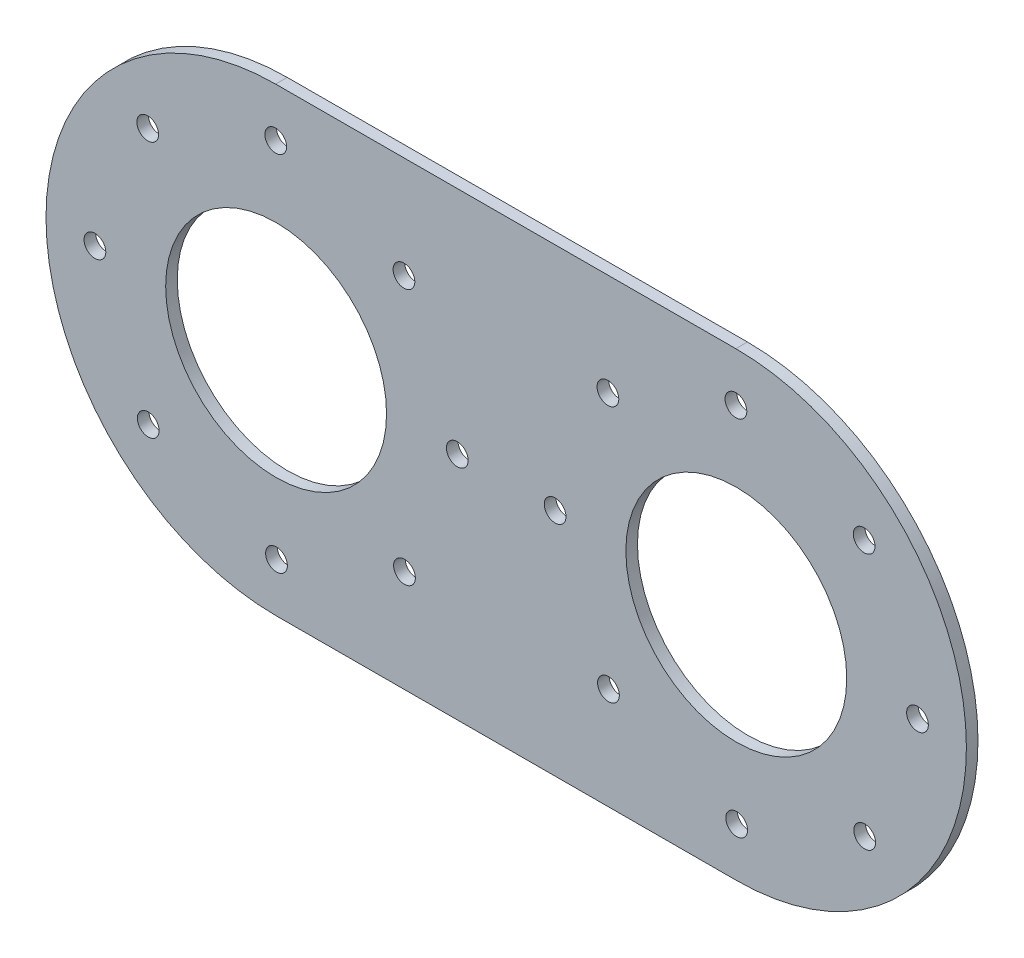
from build123d import *

# Parameters (mm, degrees)
SKETCH1_R           = 0.75
SKETCH1_R_2         = 7.62
BOSS_EXTRUDE1_DEPTH = 0.8


with BuildPart() as part:
    # Sketch1 → Boss-Extrude1 (new body)
    with BuildSketch(Plane.XY):
        with BuildLine():
            Line((31.717398128, 12.445094013), (-0.032601872, 12.379890131))
            ThreePointArc((-0.032601872, 12.379890131), (-15.874966523, -3.527678264), (0.032601872, -19.370042915))
            Line((0.032601872, -19.370042915), (31.782601872, -19.304839034))
            ThreePointArc((31.782601872, -19.304839034), (47.624966523, -3.397270638), (31.717398128, 12.445094013))
        make_face()
        with Locations((19.25, -3.45554333)):
            Circle(SKETCH1_R, mode=Mode.SUBTRACT)
        with Locations((31.75, -3.42987251)):
            Circle(SKETCH1_R_2, mode=Mode.SUBTRACT)
        with Locations((44.25, -3.404201691)):
            Circle(SKETCH1_R, mode=Mode.SUBTRACT)
        with Locations((22.929317246, -12.286859286)):
            Circle(SKETCH1_R, mode=Mode.SUBTRACT)
        with Locations((31.77567082, -15.92987251)):
            Circle(SKETCH1_R, mode=Mode.SUBTRACT)
        with Locations((40.606986775, -12.250555265)):
            Circle(SKETCH1_R, mode=Mode.SUBTRACT)
        with Locations((22.893013225, 5.390810244)):
            Circle(SKETCH1_R, mode=Mode.SUBTRACT)
        with Locations((31.72432918, 9.07012749)):
            Circle(SKETCH1_R, mode=Mode.SUBTRACT)
        with Locations((40.570682754, 5.427114265)):
            Circle(SKETCH1_R, mode=Mode.SUBTRACT)
        with Locations((0.02567082, -15.995076392)):
            Circle(SKETCH1_R, mode=Mode.SUBTRACT)
        with Locations((8.856986775, -12.315759146)):
            Circle(SKETCH1_R, mode=Mode.SUBTRACT)
        with Locations((-12.5, -3.520747212)):
            Circle(SKETCH1_R, mode=Mode.SUBTRACT)
        with Locations((0, -3.495076392)):
            Circle(SKETCH1_R_2, mode=Mode.SUBTRACT)
        with Locations((12.5, -3.469405573)):
            Circle(SKETCH1_R, mode=Mode.SUBTRACT)
        with Locations((-8.820682754, -12.352063168)):
            Circle(SKETCH1_R, mode=Mode.SUBTRACT)
        with Locations((8.820682754, 5.361910383)):
            Circle(SKETCH1_R, mode=Mode.SUBTRACT)
        with Locations((-8.856986775, 5.325606362)):
            Circle(SKETCH1_R, mode=Mode.SUBTRACT)
        with Locations((-0.02567082, 9.004923608)):
            Circle(SKETCH1_R, mode=Mode.SUBTRACT)
    extrude(amount=BOSS_EXTRUDE1_DEPTH)


solid = part.part
